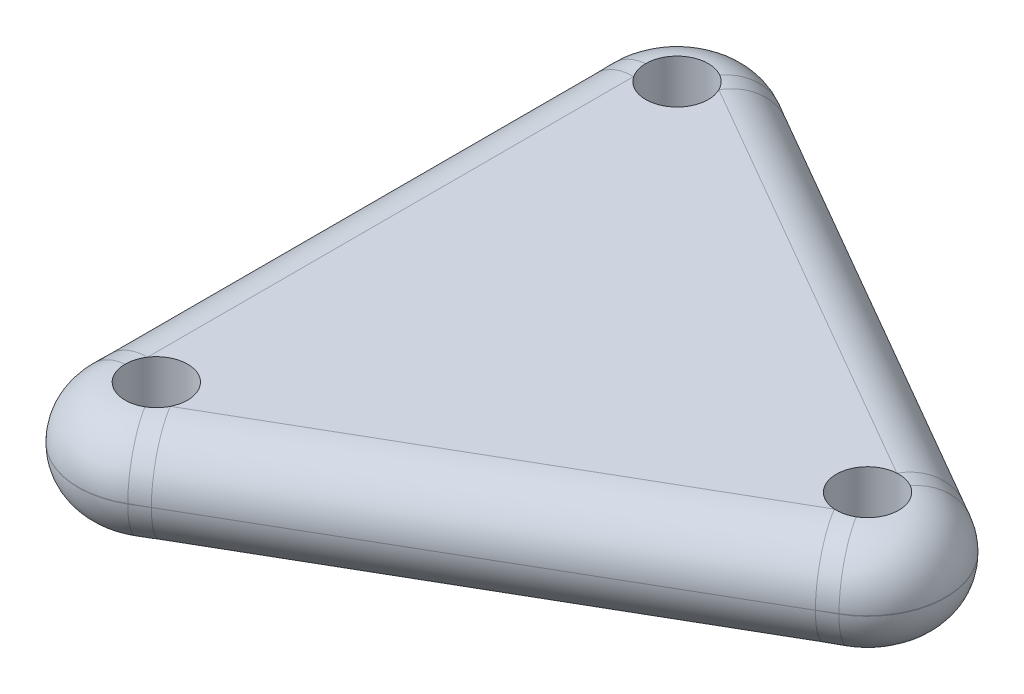
from build123d import *

# Parameters (mm, degrees)
CROQUIS2_R              = 3
SALIENTE_EXTRUIR1_DEPTH = 5
REDONDEO1_R             = 5


with BuildPart() as part:
    # Croquis2 → Saliente-Extruir1 (new, symmetric)
    with BuildSketch(Plane(origin=(0, 0, 0), x_dir=(-1, 0, 0), z_dir=(0, 1, 0))):
        with BuildLine():
            Line((7.5, 50), (7.5, 0))
            ThreePointArc((7.5, 0), (3.75, -6.495190528), (-3.75, -6.495190528))
            Line((-3.75, -6.495190528), (-47.051270189, 18.504809472))
            ThreePointArc((-47.051270189, 18.504809472), (-50.801270189, 25), (-47.051270189, 31.495190528))
            Line((-47.051270189, 31.495190528), (-3.75, 56.495190528))
            ThreePointArc((-3.75, 56.495190528), (3.75, 56.495190528), (7.5, 50))
        make_face()
        with Locations(Location((0, 0, 0), (0, 0, 90))):
            Circle(CROQUIS2_R, mode=Mode.SUBTRACT)
        with Locations(Location((-43.301270189, 25, 0), (0, 0, 90))):
            Circle(CROQUIS2_R, mode=Mode.SUBTRACT)
        with Locations(Location((0, 50, 0), (0, 0, 90))):
            Circle(CROQUIS2_R, mode=Mode.SUBTRACT)
    extrude(amount=SALIENTE_EXTRUIR1_DEPTH, both=True)

    # Redondeo1
    redondeo1_edges = [part.edges().sort_by_distance(p)[0] for p in [
        (-7.5, 5, 25),
        (25.400635095, 5, 6.004809472),
        (-7.5, -5, 25),
        (25.400635095, -5, 6.004809472),
        (25.400635095, 5, 43.995190528),
        (25.400635095, -5, 43.995190528),
    ]]
    fillet(redondeo1_edges, radius=REDONDEO1_R - 0.0001)  # a hair under: the kernel refuses the full size


solid = part.part
